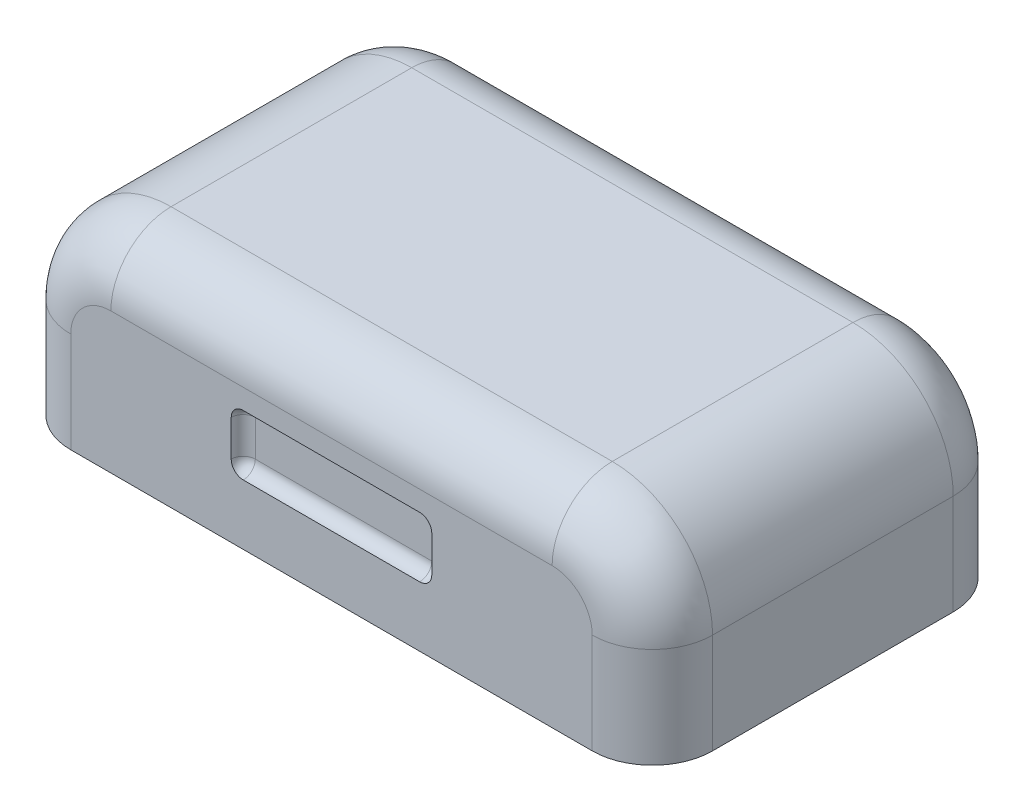
from build123d import *

# Parameters (mm, degrees)
ESQUISSE1_W             = 160
ESQUISSE1_H             = 90
EXTRUSION1_DEPTH        = 50
CONG_1_R                = 25
CONG_2_R                = 15
COQUE1_T                = -4
ESQUISSE2_W             = 50
ESQUISSE2_H             = 15
ENL_V_MAT_EXTRU_1_DEPTH = 3
CONG_4_R                = 3
CONG_5_R                = 3
CONG_6_R                = 3
CONG_7_R                = 3
CONG_4_OF_SYM_TRIE1_R   = 3
CONG_5_OF_SYM_TRIE1_R   = 3
CONG_6_OF_SYM_TRIE1_R   = 3
CONG_7_OF_SYM_TRIE1_R   = 3


with BuildPart() as part:
    # Esquisse1 → Extrusion1 (new body)
    with BuildSketch(Plane(origin=(0, 0, 0), x_dir=(1, 0, 0), z_dir=(0, 1, 0))):
        with Locations((35.341232877, 23.705753425)):
            Rectangle(ESQUISSE1_W, ESQUISSE1_H)
    extrude(amount=EXTRUSION1_DEPTH)

    # Congé1
    cong_1_edges = [part.edges().sort_by_distance(p)[0] for p in [
        (115.341232877, 50, -23.705753425),
        (-44.658767123, 50, -23.705753425),
    ]]
    fillet(cong_1_edges, radius=CONG_1_R)

    # Congé2
    cong_2_edges = [part.edges().sort_by_distance(p)[0] for p in [
        (35.341232877, 50, 21.294246575),
        (35.341232877, 50, -68.705753425),
        (115.341232877, 12.5, 21.294246575),
        (-44.658767123, 12.5, 21.294246575),
        (108.018902406, 42.67766953, 21.294246575),
        (-37.336436653, 42.67766953, 21.294246575),
        (-44.658767123, 12.5, -68.705753425),
        (115.341232877, 12.5, -68.705753425),
        (108.018902406, 42.67766953, -68.705753425),
        (-37.336436653, 42.67766953, -68.705753425),
    ]]
    fillet(cong_2_edges, radius=CONG_2_R)

    # Coque1
    coque1_openings = [part.faces().sort_by_distance(p)[0] for p in [
        (35.341232877, 0, -23.705753425),
    ]]
    offset(amount=COQUE1_T, openings=coque1_openings, kind=Kind.INTERSECTION)

    # Esquisse2 → Enlèv. mat.-Extru.1 (cut)
    with BuildSketch(Plane.XY.offset(21.294246575)):
        with Locations((35.341232877, 22.5)):
            Rectangle(ESQUISSE2_W, ESQUISSE2_H)
    enl_v_mat_extru_1 = extrude(amount=-ENL_V_MAT_EXTRU_1_DEPTH, mode=Mode.SUBTRACT)

    # Congé4
    cong_4_edges = [part.edges().sort_by_distance(p)[0] for p in [
        (35.341232877, 15, 18.294246575),
    ]]
    fillet(cong_4_edges, radius=CONG_4_R - 0.0001)  # a hair under: the kernel refuses the full size

    # Congé5
    cong_5_edges = [part.edges().sort_by_distance(p)[0] for p in [
        (35.341232877, 30, 18.294246575),
    ]]
    fillet(cong_5_edges, radius=CONG_5_R - 0.0001)  # a hair under: the kernel refuses the full size

    # Congé6
    cong_6_edges = [part.edges().sort_by_distance(p)[0] for p in [
        (10.341232877, 15.878650367, 19.172896942),
        (10.341232877, 22.5, 18.294246575),
        (10.341232877, 29.121349633, 19.172896942),
    ]]
    fillet(cong_6_edges, radius=CONG_6_R - 0.0001)  # a hair under: the kernel refuses the full size

    # Congé7
    cong_7_edges = [part.edges().sort_by_distance(p)[0] for p in [
        (60.341232877, 22.5, 18.294246575),
        (60.341232877, 15.878650367, 19.172896942),
        (60.341232877, 29.121349633, 19.172896942),
    ]]
    fillet(cong_7_edges, radius=CONG_7_R - 0.0001)  # a hair under: the kernel refuses the full size

    # Symétrie1: Enlèv. mat.-Extru.1 across plane
    add(enl_v_mat_extru_1.mirror(Plane.XY.offset(-23.705753425)), mode=Mode.SUBTRACT)

    # Congé4 of Symétrie1
    cong_4_of_sym_trie1_edges = [part.edges().sort_by_distance(p)[0] for p in [
        (35.341232877, 15, -65.705753425),
    ]]
    fillet(cong_4_of_sym_trie1_edges, radius=CONG_4_OF_SYM_TRIE1_R - 0.0001)  # a hair under: the kernel refuses the full size

    # Congé5 of Symétrie1
    cong_5_of_sym_trie1_edges = [part.edges().sort_by_distance(p)[0] for p in [
        (35.341232877, 30, -65.705753425),
    ]]
    fillet(cong_5_of_sym_trie1_edges, radius=CONG_5_OF_SYM_TRIE1_R - 0.0001)  # a hair under: the kernel refuses the full size

    # Congé6 of Symétrie1
    cong_6_of_sym_trie1_edges = [part.edges().sort_by_distance(p)[0] for p in [
        (10.341232877, 15.878650367, -66.584403792),
        (10.341232877, 22.5, -65.705753425),
        (10.341232877, 29.121349633, -66.584403792),
    ]]
    fillet(cong_6_of_sym_trie1_edges, radius=CONG_6_OF_SYM_TRIE1_R - 0.0001)  # a hair under: the kernel refuses the full size

    # Congé7 of Symétrie1
    cong_7_of_sym_trie1_edges = [part.edges().sort_by_distance(p)[0] for p in [
        (60.341232877, 22.5, -65.705753425),
        (60.341232877, 15.878650367, -66.584403792),
        (60.341232877, 29.121349633, -66.584403792),
    ]]
    fillet(cong_7_of_sym_trie1_edges, radius=CONG_7_OF_SYM_TRIE1_R - 0.0001)  # a hair under: the kernel refuses the full size


solid = part.part
